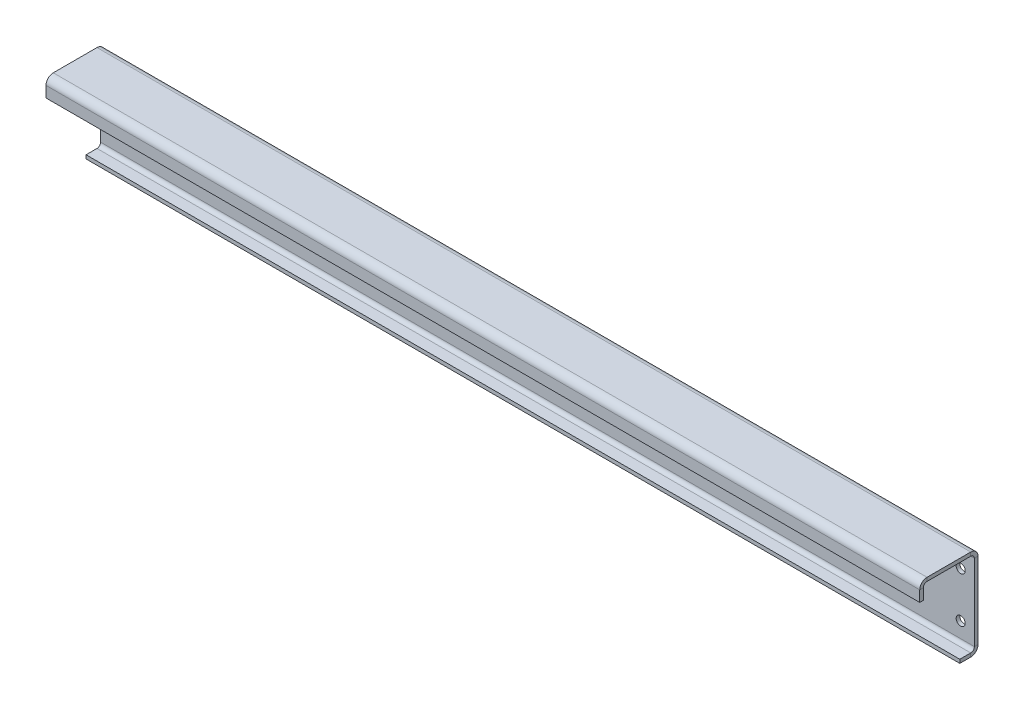
from build123d import *

# Parameters (mm, degrees)
EXTRUDE_1_DEPTH       = 240
SHEET_START           = -240
SHEET_METAL_1_DEPTH   = 480
SHEET_METAL_1_2_DEPTH = 480
CUT_EXTRUDE_1_REACH   = 247.072
SKETCH_7_R            = 2.5


# Read off the part's stored shape, not the designer's step: Преобразовать-Твердое тело1
with BuildPart() as part:
    # Sketch 1 → Вытянуть-Тонкостенный1 (new, symmetric)
    with BuildSketch(Plane(origin=(0, 0, 0), x_dir=(0, 0, -1), z_dir=(1, 0, 0))):
        Polygon((-19.047619048, 27.896825397), (-19.047619048, 37.896825397), (12.952380952, 37.896825397), (12.952380952, -12.103174603), (2.952380952, -12.103174603), (2.952380952, -10.103174603), (10.952380952, -10.103174603), (10.952380952, 35.896825397), (-17.047619048, 35.896825397), (-17.047619048, 27.896825397), align=None)
    extrude(amount=EXTRUDE_1_DEPTH, both=True)

    # Sheet Metal 1 outline → Sheet Metal 1 (cut)
    with BuildSketch(Plane.YZ.offset(SHEET_START)):
        with BuildLine():
            Line((-12.103174603, -12.952380952), (-8.103174603, -12.952380952))
            ThreePointArc((-8.103174603, -12.952380952), (-10.931601728, -11.780808077), (-12.103174603, -8.952380952))
            Line((-12.103174603, -8.952380952), (-12.103174603, -12.952380952))
        make_face()
        with BuildLine():
            ThreePointArc((33.896825397, 19.047619048), (36.725252521, 17.876046172), (37.896825397, 15.047619048))
            Line((37.896825397, 15.047619048), (37.896825397, 19.047619048))
            Line((37.896825397, 19.047619048), (33.896825397, 19.047619048))
        make_face()
        with BuildLine():
            ThreePointArc((37.896825397, -8.952380952), (36.725252522, -11.780808077), (33.896825397, -12.952380952))
            Line((33.896825397, -12.952380952), (37.896825397, -12.952380952))
            Line((37.896825397, -12.952380952), (37.896825397, -8.952380952))
        make_face()
    extrude(amount=SHEET_METAL_1_DEPTH, mode=Mode.SUBTRACT)

    # Sheet Metal 1 2 outline → Sheet Metal 1 2 (add)
    with BuildSketch(Plane.YZ.offset(SHEET_START)):
        with BuildLine():
            Line((-10.103174603, -10.952380952), (-8.103174603, -10.952380952))
            ThreePointArc((-8.103174603, -10.952380952), (-9.517388166, -10.366594515), (-10.103174603, -8.952380952))
            Line((-10.103174603, -8.952380952), (-10.103174603, -10.952380952))
        make_face()
        with BuildLine():
            ThreePointArc((33.896825397, 17.047619048), (35.311038959, 16.46183261), (35.896825397, 15.047619048))
            Line((35.896825397, 15.047619048), (35.896825397, 17.047619048))
            Line((35.896825397, 17.047619048), (33.896825397, 17.047619048))
        make_face()
        with BuildLine():
            ThreePointArc((35.896825397, -8.952380952), (35.31103896, -10.366594515), (33.896825397, -10.952380952))
            Line((33.896825397, -10.952380952), (35.896825397, -10.952380952))
            Line((35.896825397, -10.952380952), (35.896825397, -8.952380952))
        make_face()
    extrude(amount=SHEET_METAL_1_2_DEPTH)

    # Эскиз7 → Вырез-Вытянуть1 (cut, up to next)
    with BuildSketch(Plane(origin=(0, 0, -12.952380952), x_dir=(-1, 0, 0), z_dir=(0, 0, -1)), mode=Mode.PRIVATE) as cut_extrude_1_sk1:
        with Locations(Location((-207.5, 25.396825397, 0), (0, 0, 90))):
            Circle(SKETCH_7_R)
    cut_extrude_1_tool1 = extrude(cut_extrude_1_sk1.sketch, amount=-CUT_EXTRUDE_1_REACH, mode=Mode.PRIVATE) & part.part
    # Эскиз7 → Вырез-Вытянуть1 (cut, up to next)
    with BuildSketch(Plane(origin=(0, 0, -12.952380952), x_dir=(-1, 0, 0), z_dir=(0, 0, -1)), mode=Mode.PRIVATE) as cut_extrude_1_sk2:
        with Locations(Location((-232.5, 25.396825397, 0), (0, 0, 90))):
            Circle(SKETCH_7_R)
    cut_extrude_1_tool2 = extrude(cut_extrude_1_sk2.sketch, amount=-CUT_EXTRUDE_1_REACH, mode=Mode.PRIVATE) & part.part
    # Эскиз7 → Вырез-Вытянуть1 (cut, up to next)
    with BuildSketch(Plane(origin=(0, 0, -12.952380952), x_dir=(-1, 0, 0), z_dir=(0, 0, -1)), mode=Mode.PRIVATE) as cut_extrude_1_sk3:
        with Locations(Location((-232.5, 0.396825397, 0), (0, 0, 90))):
            Circle(SKETCH_7_R)
    cut_extrude_1_tool3 = extrude(cut_extrude_1_sk3.sketch, amount=-CUT_EXTRUDE_1_REACH, mode=Mode.PRIVATE) & part.part
    # Эскиз7 → Вырез-Вытянуть1 (cut, up to next)
    with BuildSketch(Plane(origin=(0, 0, -12.952380952), x_dir=(-1, 0, 0), z_dir=(0, 0, -1)), mode=Mode.PRIVATE) as cut_extrude_1_sk4:
        with Locations(Location((-207.5, 0.396825397, 0), (0, 0, 90))):
            Circle(SKETCH_7_R)
    cut_extrude_1_tool4 = extrude(cut_extrude_1_sk4.sketch, amount=-CUT_EXTRUDE_1_REACH, mode=Mode.PRIVATE) & part.part
    # Эскиз7 → Вырез-Вытянуть1 (cut, up to next)
    with BuildSketch(Plane(origin=(0, 0, -12.952380952), x_dir=(-1, 0, 0), z_dir=(0, 0, -1)), mode=Mode.PRIVATE) as cut_extrude_1_sk5:
        with Locations(Location((232.5, 25.396825397, 0), (0, 0, 90))):
            Circle(SKETCH_7_R)
    cut_extrude_1_tool5 = extrude(cut_extrude_1_sk5.sketch, amount=-CUT_EXTRUDE_1_REACH, mode=Mode.PRIVATE) & part.part
    # Эскиз7 → Вырез-Вытянуть1 (cut, up to next)
    with BuildSketch(Plane(origin=(0, 0, -12.952380952), x_dir=(-1, 0, 0), z_dir=(0, 0, -1)), mode=Mode.PRIVATE) as cut_extrude_1_sk6:
        with Locations(Location((207.5, 25.396825397, 0), (0, 0, 90))):
            Circle(SKETCH_7_R)
    cut_extrude_1_tool6 = extrude(cut_extrude_1_sk6.sketch, amount=-CUT_EXTRUDE_1_REACH, mode=Mode.PRIVATE) & part.part
    # Эскиз7 → Вырез-Вытянуть1 (cut, up to next)
    with BuildSketch(Plane(origin=(0, 0, -12.952380952), x_dir=(-1, 0, 0), z_dir=(0, 0, -1)), mode=Mode.PRIVATE) as cut_extrude_1_sk7:
        with Locations(Location((207.5, 0.396825397, 0), (0, 0, 90))):
            Circle(SKETCH_7_R)
    cut_extrude_1_tool7 = extrude(cut_extrude_1_sk7.sketch, amount=-CUT_EXTRUDE_1_REACH, mode=Mode.PRIVATE) & part.part
    # Эскиз7 → Вырез-Вытянуть1 (cut, up to next)
    with BuildSketch(Plane(origin=(0, 0, -12.952380952), x_dir=(-1, 0, 0), z_dir=(0, 0, -1)), mode=Mode.PRIVATE) as cut_extrude_1_sk8:
        with Locations(Location((232.5, 0.396825397, 0), (0, 0, 90))):
            Circle(SKETCH_7_R)
    cut_extrude_1_tool8 = extrude(cut_extrude_1_sk8.sketch, amount=-CUT_EXTRUDE_1_REACH, mode=Mode.PRIVATE) & part.part
    add(cut_extrude_1_tool1.solids().sort_by_distance((207.5, 25.396825, -12.952381))[0], mode=Mode.SUBTRACT)
    add(cut_extrude_1_tool2.solids().sort_by_distance((232.5, 25.396825, -12.952381))[0], mode=Mode.SUBTRACT)
    add(cut_extrude_1_tool3.solids().sort_by_distance((232.5, 0.396825, -12.952381))[0], mode=Mode.SUBTRACT)
    add(cut_extrude_1_tool4.solids().sort_by_distance((207.5, 0.396825, -12.952381))[0], mode=Mode.SUBTRACT)
    add(cut_extrude_1_tool5.solids().sort_by_distance((-232.5, 25.396825, -12.952381))[0], mode=Mode.SUBTRACT)
    add(cut_extrude_1_tool6.solids().sort_by_distance((-207.5, 25.396825, -12.952381))[0], mode=Mode.SUBTRACT)
    add(cut_extrude_1_tool7.solids().sort_by_distance((-207.5, 0.396825, -12.952381))[0], mode=Mode.SUBTRACT)
    add(cut_extrude_1_tool8.solids().sort_by_distance((-232.5, 0.396825, -12.952381))[0], mode=Mode.SUBTRACT)


solid = part.part
